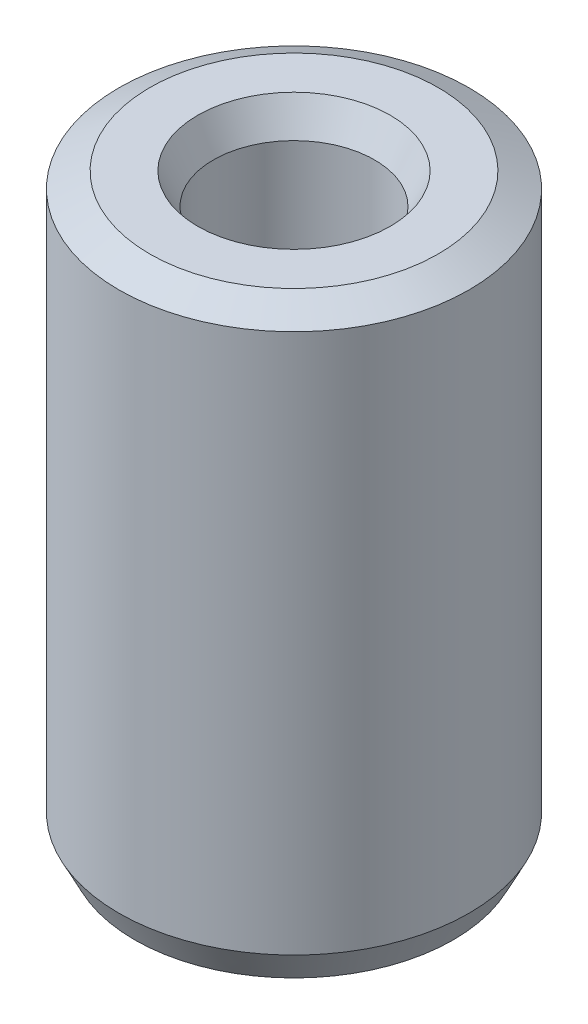
from build123d import *
from OCP.BRepFilletAPI import BRepFilletAPI_MakeChamfer

# Parameters (mm, degrees)
SKETCH1_R           = 5
BOSS_EXTRUDE1_DEPTH = 16.745801266
SKETCH2_R           = 2.303296217
CUT_EXTRUDE1_DEPTH  = 19.177509731
CHAMFER1_SIZE       = 0.446183577
CHAMFER1_SIZE2      = 0.88154203


with BuildPart() as part:
    # Sketch1 → Boss-Extrude1 (new body)
    with BuildSketch(Plane(origin=(0, 0, 0), x_dir=(1, 0, 0), z_dir=(0, 1, 0))):
        Circle(SKETCH1_R)
    extrude(amount=BOSS_EXTRUDE1_DEPTH)

    # Sketch2 → Cut-Extrude1 (cut, through all)
    with BuildSketch(Plane(origin=(0, 0, 0), x_dir=(1, 0, 0), z_dir=(0, 1, 0))):
        Circle(SKETCH2_R)
    extrude(amount=CUT_EXTRUDE1_DEPTH, mode=Mode.SUBTRACT)

    # Chamfer1: one chamfer whose edges measure the first distance from different faces: ONE call of the kernel's chamfer builder (chamfer() names one face for all edges)
    chamfer1_edges_1 = [part.edges().sort_by_distance(p)[0] for p in [
        (-2.303296217, 16.745801266, 0),
    ]]
    chamfer1_side_1 = [part.faces().sort_by_distance(p)[0] for p in [
        (-4.858578644, 16.745801266, 0),
    ]]
    chamfer1_edges_2 = [part.edges().sort_by_distance(p)[0] for p in [
        (-2.303296217, 0, 0),
    ]]
    chamfer1_side_2 = [part.faces().sort_by_distance(p)[0] for p in [
        (-2.303296217, 8.372900633, 0),
    ]]
    chamfer1_edges_3 = [part.edges().sort_by_distance(p)[0] for p in [
        (-5, 0, 0),
    ]]
    chamfer1_side_3 = [part.faces().sort_by_distance(p)[0] for p in [
        (-4.858578644, 0, 0),
    ]]
    chamfer1_edges_4 = [part.edges().sort_by_distance(p)[0] for p in [
        (-5, 16.745801266, 0),
    ]]
    chamfer1_side_4 = [part.faces().sort_by_distance(p)[0] for p in [
        (-5, 8.372900633, 0),
    ]]
    chamfer1 = BRepFilletAPI_MakeChamfer(part.part.solid().wrapped)
    for e in chamfer1_edges_1:
        chamfer1.Add(CHAMFER1_SIZE, CHAMFER1_SIZE2, e.wrapped, chamfer1_side_1[0].wrapped)  # the first distance lies on this face
    for e in chamfer1_edges_2:
        chamfer1.Add(CHAMFER1_SIZE, CHAMFER1_SIZE2, e.wrapped, chamfer1_side_2[0].wrapped)  # the first distance lies on this face
    for e in chamfer1_edges_3:
        chamfer1.Add(CHAMFER1_SIZE, CHAMFER1_SIZE2, e.wrapped, chamfer1_side_3[0].wrapped)  # the first distance lies on this face
    for e in chamfer1_edges_4:
        chamfer1.Add(CHAMFER1_SIZE, CHAMFER1_SIZE2, e.wrapped, chamfer1_side_4[0].wrapped)  # the first distance lies on this face
    add(Compound.cast(chamfer1.Shape()), mode=Mode.REPLACE)


solid = part.part
